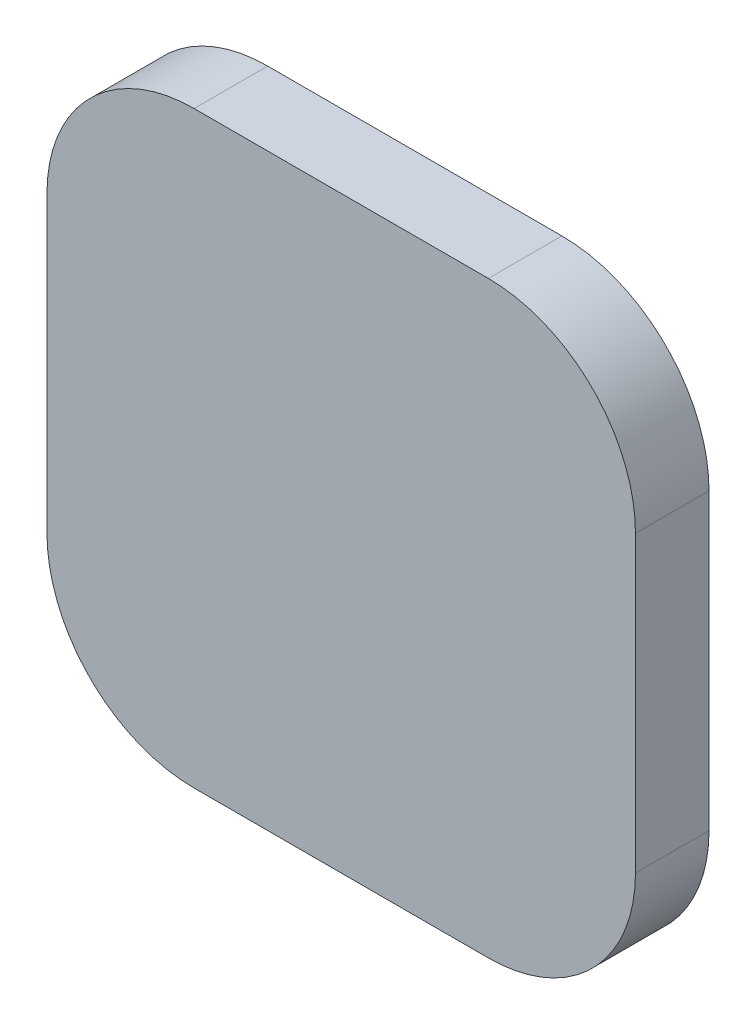
from build123d import *

# Parameters (mm, degrees)
BOSS_EXTRUDE2_DEPTH = 2
FILLET1_R           = 4


with BuildPart() as part:
    # Sketch1 → Boss-Extrude2 (new body)
    with BuildSketch(Plane.XY):
        Polygon((0, 16), (0, 0), (16, 0), (16, 9.9872583), (16, 12.25), (16, 16), align=None)
    extrude(amount=BOSS_EXTRUDE2_DEPTH)

    # Fillet1
    fillet1_edges = [part.edges().sort_by_distance(p)[0] for p in [
        (0, 0, 1),
        (16, 0, 1),
        (16, 16, 1),
        (0, 16, 1),
    ]]
    fillet(fillet1_edges, radius=FILLET1_R)


solid = part.part
